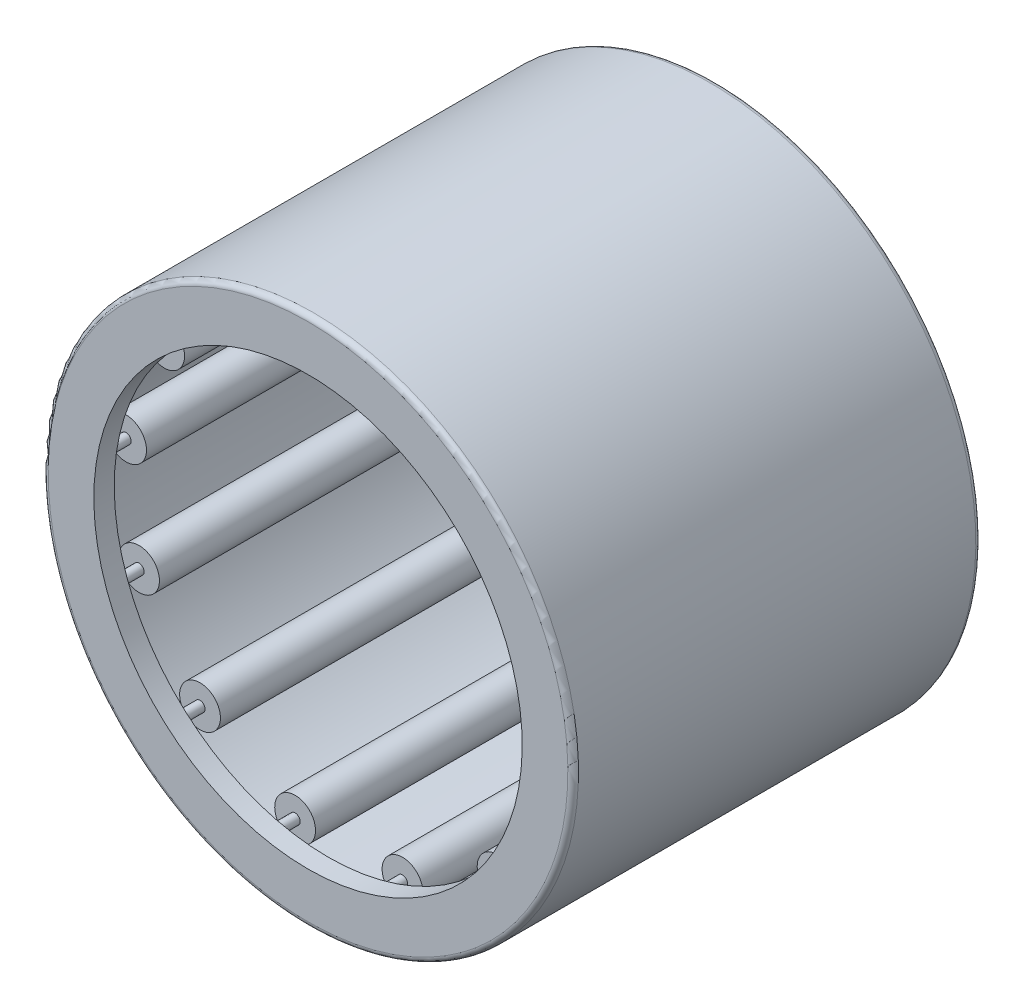
from build123d import *

# Parameters (mm, degrees)
SKETCH2_W         = 12.7
SKETCH2_H         = 0.5953125
SKETCH3_W         = 14.2875
SKETCH3_H         = 0.1984375
CIRPATTERN1_COUNT = 13
CIRPATTERN1_ANGLE = 332.307692308
FILLET1_R         = 0.206375


with BuildPart() as part:
    # Sketch1 → Revolve1 (revolve)
    with BuildSketch(Plane(origin=(0, 0, 0), x_dir=(0, 0, -1), z_dir=(1, 0, 0))):
        Polygon((-7.9375, 10.31875), (7.9375, 10.31875), (7.9375, 8.334375), (7.14375, 8.334375), (7.14375, 9.525), (-7.14375, 9.525), (-7.14375, 8.334375), (-7.9375, 8.334375), align=None)
    revolve(axis=Axis((0, 0, 7.9375), (0, 0, -1)))

    # Fillet1
    fillet1_edges = [part.edges().sort_by_distance(p)[0] for p in [
        (0, -10.31875, -7.9375),
        (0, -10.31875, 7.9375),
    ]]
    fillet(fillet1_edges, radius=FILLET1_R)


with BuildPart() as body_2:
    # Sketch2 → Revolve2 (revolve)
    with BuildSketch(Plane(origin=(0, 0, 0), x_dir=(0, 0, -1), z_dir=(1, 0, 0))):
        with Locations((0, 9.22734375)):
            Rectangle(SKETCH2_W, SKETCH2_H)
    revolve(axis=Axis((0, 8.73125, 6.35), (0, 0, -1)))


with BuildPart() as body_3:
    # Sketch3 → Revolve3 (revolve)
    with BuildSketch(Plane(origin=(0, 0, 0), x_dir=(0, 0, -1), z_dir=(1, 0, 0))):
        with Locations((0, 8.83046875)):
            Rectangle(SKETCH3_W, SKETCH3_H)
    revolve(axis=Axis((0, 8.73125, 7.14375), (0, 0, -1)))


with BuildPart() as cirpattern1_1:
    # CirPattern1: pattern copy
    add(body_2.part.rotate(Axis((0, 0, -7.9375), (0, 0, 1)), 1 * CIRPATTERN1_ANGLE / (CIRPATTERN1_COUNT - 1)))


with BuildPart() as cirpattern1_2:
    # CirPattern1: pattern copy
    add(body_2.part.rotate(Axis((0, 0, -7.9375), (0, 0, 1)), 2 * CIRPATTERN1_ANGLE / (CIRPATTERN1_COUNT - 1)))


with BuildPart() as cirpattern1_3:
    # CirPattern1: pattern copy
    add(body_2.part.rotate(Axis((0, 0, -7.9375), (0, 0, 1)), 3 * CIRPATTERN1_ANGLE / (CIRPATTERN1_COUNT - 1)))


with BuildPart() as cirpattern1_4:
    # CirPattern1: pattern copy
    add(body_2.part.rotate(Axis((0, 0, -7.9375), (0, 0, 1)), 4 * CIRPATTERN1_ANGLE / (CIRPATTERN1_COUNT - 1)))


with BuildPart() as cirpattern1_5:
    # CirPattern1: pattern copy
    add(body_2.part.rotate(Axis((0, 0, -7.9375), (0, 0, 1)), 5 * CIRPATTERN1_ANGLE / (CIRPATTERN1_COUNT - 1)))


with BuildPart() as cirpattern1_6:
    # CirPattern1: pattern copy
    add(body_2.part.rotate(Axis((0, 0, -7.9375), (0, 0, 1)), 6 * CIRPATTERN1_ANGLE / (CIRPATTERN1_COUNT - 1)))


with BuildPart() as cirpattern1_7:
    # CirPattern1: pattern copy
    add(body_2.part.rotate(Axis((0, 0, -7.9375), (0, 0, 1)), 7 * CIRPATTERN1_ANGLE / (CIRPATTERN1_COUNT - 1)))


with BuildPart() as cirpattern1_8:
    # CirPattern1: pattern copy
    add(body_2.part.rotate(Axis((0, 0, -7.9375), (0, 0, 1)), 8 * CIRPATTERN1_ANGLE / (CIRPATTERN1_COUNT - 1)))


with BuildPart() as cirpattern1_9:
    # CirPattern1: pattern copy
    add(body_2.part.rotate(Axis((0, 0, -7.9375), (0, 0, 1)), 9 * CIRPATTERN1_ANGLE / (CIRPATTERN1_COUNT - 1)))


with BuildPart() as cirpattern1_10:
    # CirPattern1: pattern copy
    add(body_2.part.rotate(Axis((0, 0, -7.9375), (0, 0, 1)), 10 * CIRPATTERN1_ANGLE / (CIRPATTERN1_COUNT - 1)))


with BuildPart() as cirpattern1_11:
    # CirPattern1: pattern copy
    add(body_2.part.rotate(Axis((0, 0, -7.9375), (0, 0, 1)), 11 * CIRPATTERN1_ANGLE / (CIRPATTERN1_COUNT - 1)))


with BuildPart() as cirpattern1_12:
    # CirPattern1: pattern copy
    add(body_2.part.rotate(Axis((0, 0, -7.9375), (0, 0, 1)), 12 * CIRPATTERN1_ANGLE / (CIRPATTERN1_COUNT - 1)))


with BuildPart() as cirpattern1_13:
    # CirPattern1: pattern copy
    add(body_3.part.rotate(Axis((0, 0, -7.9375), (0, 0, 1)), 1 * CIRPATTERN1_ANGLE / (CIRPATTERN1_COUNT - 1)))


with BuildPart() as cirpattern1_14:
    # CirPattern1: pattern copy
    add(body_3.part.rotate(Axis((0, 0, -7.9375), (0, 0, 1)), 2 * CIRPATTERN1_ANGLE / (CIRPATTERN1_COUNT - 1)))


with BuildPart() as cirpattern1_15:
    # CirPattern1: pattern copy
    add(body_3.part.rotate(Axis((0, 0, -7.9375), (0, 0, 1)), 3 * CIRPATTERN1_ANGLE / (CIRPATTERN1_COUNT - 1)))


with BuildPart() as cirpattern1_16:
    # CirPattern1: pattern copy
    add(body_3.part.rotate(Axis((0, 0, -7.9375), (0, 0, 1)), 4 * CIRPATTERN1_ANGLE / (CIRPATTERN1_COUNT - 1)))


with BuildPart() as cirpattern1_17:
    # CirPattern1: pattern copy
    add(body_3.part.rotate(Axis((0, 0, -7.9375), (0, 0, 1)), 5 * CIRPATTERN1_ANGLE / (CIRPATTERN1_COUNT - 1)))


with BuildPart() as cirpattern1_18:
    # CirPattern1: pattern copy
    add(body_3.part.rotate(Axis((0, 0, -7.9375), (0, 0, 1)), 6 * CIRPATTERN1_ANGLE / (CIRPATTERN1_COUNT - 1)))


with BuildPart() as cirpattern1_19:
    # CirPattern1: pattern copy
    add(body_3.part.rotate(Axis((0, 0, -7.9375), (0, 0, 1)), 7 * CIRPATTERN1_ANGLE / (CIRPATTERN1_COUNT - 1)))


with BuildPart() as cirpattern1_20:
    # CirPattern1: pattern copy
    add(body_3.part.rotate(Axis((0, 0, -7.9375), (0, 0, 1)), 8 * CIRPATTERN1_ANGLE / (CIRPATTERN1_COUNT - 1)))


with BuildPart() as cirpattern1_21:
    # CirPattern1: pattern copy
    add(body_3.part.rotate(Axis((0, 0, -7.9375), (0, 0, 1)), 9 * CIRPATTERN1_ANGLE / (CIRPATTERN1_COUNT - 1)))


with BuildPart() as cirpattern1_22:
    # CirPattern1: pattern copy
    add(body_3.part.rotate(Axis((0, 0, -7.9375), (0, 0, 1)), 10 * CIRPATTERN1_ANGLE / (CIRPATTERN1_COUNT - 1)))


with BuildPart() as cirpattern1_23:
    # CirPattern1: pattern copy
    add(body_3.part.rotate(Axis((0, 0, -7.9375), (0, 0, 1)), 11 * CIRPATTERN1_ANGLE / (CIRPATTERN1_COUNT - 1)))


with BuildPart() as cirpattern1_24:
    # CirPattern1: pattern copy
    add(body_3.part.rotate(Axis((0, 0, -7.9375), (0, 0, 1)), 12 * CIRPATTERN1_ANGLE / (CIRPATTERN1_COUNT - 1)))


solid = Compound([part.part, body_2.part, body_3.part, cirpattern1_1.part, cirpattern1_2.part, cirpattern1_3.part, cirpattern1_4.part, cirpattern1_5.part, cirpattern1_6.part, cirpattern1_7.part, cirpattern1_8.part, cirpattern1_9.part, cirpattern1_10.part, cirpattern1_11.part, cirpattern1_12.part, cirpattern1_13.part, cirpattern1_14.part, cirpattern1_15.part, cirpattern1_16.part, cirpattern1_17.part, cirpattern1_18.part, cirpattern1_19.part, cirpattern1_20.part, cirpattern1_21.part, cirpattern1_22.part, cirpattern1_23.part, cirpattern1_24.part])
